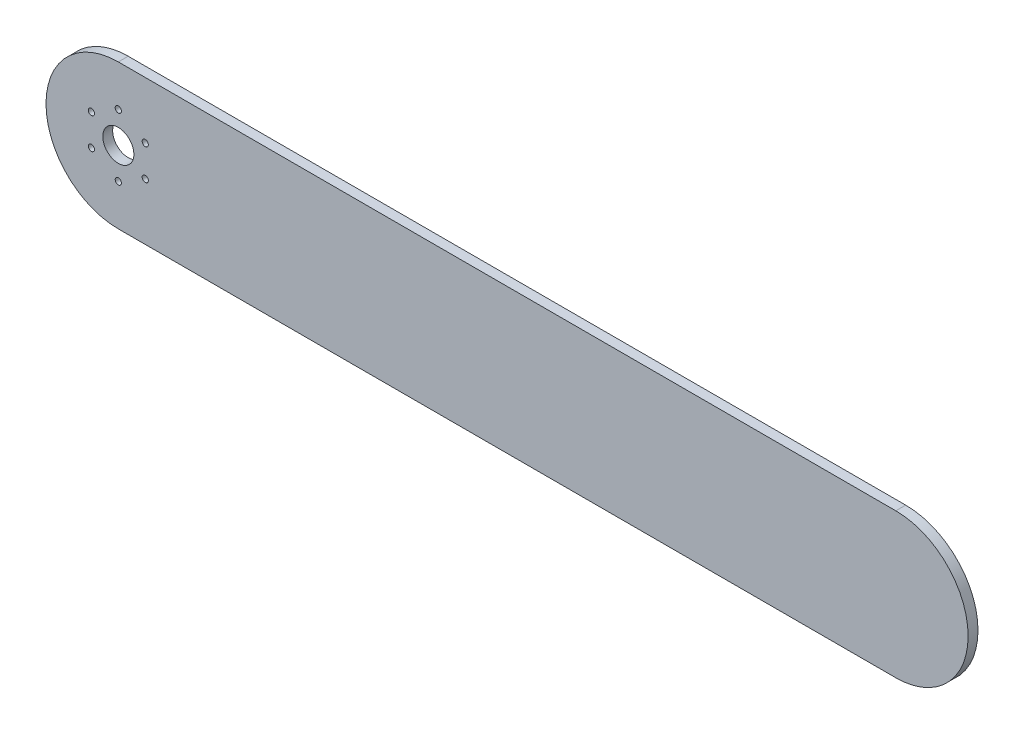
from build123d import *

# Parameters (mm, degrees)
SKETCH2_R           = 10
SKETCH2_R_2         = 2
BOSS_EXTRUDE1_DEPTH = 6.35


with BuildPart() as part:
    # Sketch2 → Boss-Extrude1 (new body)
    with BuildSketch(Plane.XY):
        with BuildLine():
            Line((0, 46.5), (500, 46.5))
            ThreePointArc((500, 46.5), (546.5, 0), (500, -46.5))
            Line((500, -46.5), (0, -46.5))
            ThreePointArc((0, -46.5), (-46.5, 0), (0, 46.5))
        make_face()
        Circle(SKETCH2_R, mode=Mode.SUBTRACT)
        with Locations((0, 20)):
            Circle(SKETCH2_R_2, mode=Mode.SUBTRACT)
        with Locations((17.320508076, 10)):
            Circle(SKETCH2_R_2, mode=Mode.SUBTRACT)
        with Locations((17.320508076, -10)):
            Circle(SKETCH2_R_2, mode=Mode.SUBTRACT)
        with Locations((0, -20)):
            Circle(SKETCH2_R_2, mode=Mode.SUBTRACT)
        with Locations((-17.320508076, -10)):
            Circle(SKETCH2_R_2, mode=Mode.SUBTRACT)
        with Locations((-17.320508076, 10)):
            Circle(SKETCH2_R_2, mode=Mode.SUBTRACT)
    extrude(amount=BOSS_EXTRUDE1_DEPTH)


solid = part.part
